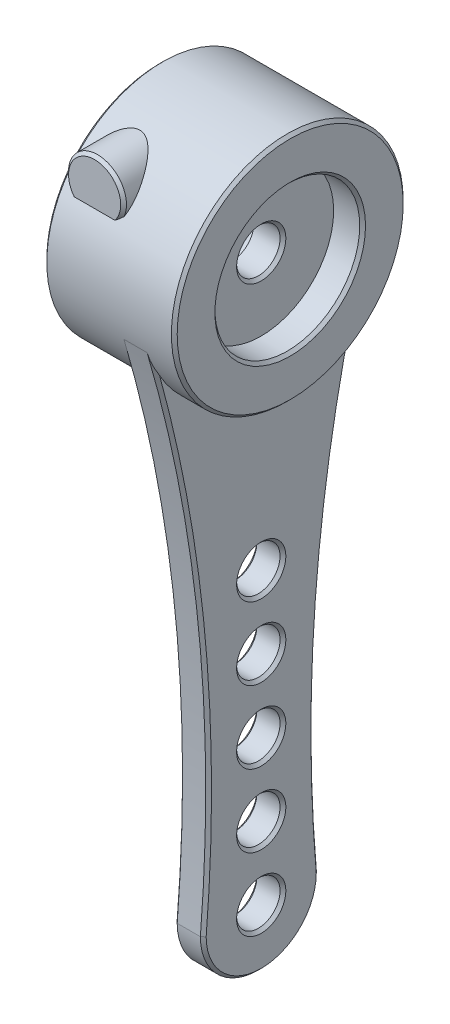
from build123d import *

# Parameters (mm, degrees)
EXTRUDE_1_DEPTH      = 2
EXTRUDE_2_DEPTH      = 4
EXTRUDE_2_DEPTH_BACK = 5
SKETCH_3_R           = 5
CUT_EXTRUDE_1_DEPTH  = 2
SKETCH_4_R           = 1.5
CUT_EXTRUDE_2_DEPTH  = 2
SKETCH_5_R           = 3
CUT_EXTRUDE_3_DEPTH  = 5
EXTRUDE_3_REACH      = 51.588
CHAMFER_1_SIZE       = 0.2
CHAMFER_2_SIZE       = 0.2
CHAMFER_3_SIZE       = 0.2
CHAMFER_4_ANGLE      = 180
CHAMFER_5_SIZE       = 0.2


with BuildPart() as part:
    # 草图1 → 凸台-拉伸1 (new body)
    with BuildSketch(Plane(origin=(0, 0, 0), x_dir=(0, 0, -1), z_dir=(1, 0, 0))):
        with BuildLine():
            ThreePointArc((-4, 0), (-2.828427125, -2.828427125), (0, -4))
            Line((0, -4), (0, -1.5))
            ThreePointArc((0, -1.5), (-1.5, 0), (0, 1.5))
            Line((0, 1.5), (0, 3.5))
            ThreePointArc((0, 3.5), (-1.5, 5), (0, 6.5))
            Line((0, 6.5), (0, 8.5))
            ThreePointArc((0, 8.5), (-1.5, 10), (0, 11.5))
            Line((0, 11.5), (0, 13.5))
            ThreePointArc((0, 13.5), (-1.5, 15), (0, 16.5))
            Line((0, 16.5), (0, 18.5))
            ThreePointArc((0, 18.5), (-1.5, 20), (0, 21.5))
            Line((0, 21.5), (0, 31))
            ThreePointArc((0, 31), (-4.794759251, 32.596072789), (-7.67632231, 36.747429069))
            ThreePointArc((-7.67632231, 36.747429069), (-4.127055678, 18.544898625), (-4, 0))
        make_face()
        with BuildLine():
            Line((0, -1.5), (0, -4))
            ThreePointArc((0, -4), (2.828427125, -2.828427125), (4, 0))
            ThreePointArc((4, 0), (4.127055678, 18.544898625), (7.67632231, 36.747429069))
            ThreePointArc((7.67632231, 36.747429069), (4.794759251, 32.596072789), (0, 31))
            Line((0, 31), (0, 21.5))
            ThreePointArc((0, 21.5), (1.060660172, 21.060660172), (1.5, 20))
            ThreePointArc((1.5, 20), (1.060660172, 18.939339828), (0, 18.5))
            Line((0, 18.5), (0, 16.5))
            ThreePointArc((0, 16.5), (1.060660172, 16.060660172), (1.5, 15))
            ThreePointArc((1.5, 15), (1.060660172, 13.939339828), (0, 13.5))
            Line((0, 13.5), (0, 11.5))
            ThreePointArc((0, 11.5), (1.060660172, 11.060660172), (1.5, 10))
            ThreePointArc((1.5, 10), (1.060660172, 8.939339828), (0, 8.5))
            Line((0, 8.5), (0, 6.5))
            ThreePointArc((0, 6.5), (1.060660172, 6.060660172), (1.5, 5))
            ThreePointArc((1.5, 5), (1.060660172, 3.939339828), (0, 3.5))
            Line((0, 3.5), (0, 1.5))
            ThreePointArc((0, 1.5), (1.060660172, 1.060660172), (1.5, 0))
            ThreePointArc((1.5, 0), (1.060660172, -1.060660172), (0, -1.5))
        make_face()
    extrude(amount=EXTRUDE_1_DEPTH)

    # 草图2 → 凸台-拉伸2 (add, two sides: drawn at the far end of the back side and taken through both)
    with BuildSketch(Plane(origin=(0, 0, 0), x_dir=(0, 0, -1), z_dir=(1, 0, 0)).offset(-EXTRUDE_2_DEPTH_BACK)):
        with BuildLine():
            ThreePointArc((0, 47), (-8, 39), (0, 31))
            Line((0, 31), (0, 47))
        make_face()
        with BuildLine():
            Line((0, 47), (0, 31))
            ThreePointArc((0, 31), (5.656854249, 33.343145751), (8, 39))
            ThreePointArc((8, 39), (5.656854249, 44.656854249), (0, 47))
        make_face()
    extrude(amount=EXTRUDE_2_DEPTH + EXTRUDE_2_DEPTH_BACK)

    # 草图3 → 切除-拉伸1 (cut)
    with BuildSketch(Plane(origin=(4, 0, 0), x_dir=(0, 0, -1), z_dir=(1, 0, 0))):
        with Locations((0, 39)):
            Circle(SKETCH_3_R)
    extrude(amount=-CUT_EXTRUDE_1_DEPTH, mode=Mode.SUBTRACT)

    # 草图4 → 切除-拉伸2 (cut)
    with BuildSketch(Plane(origin=(2, 0, 0), x_dir=(0, 0, -1), z_dir=(1, 0, 0))):
        with Locations((0, 39)):
            Circle(SKETCH_4_R)
    extrude(amount=-CUT_EXTRUDE_2_DEPTH, mode=Mode.SUBTRACT)

    # 草图5 → 切除-拉伸3 (cut)
    with BuildSketch(Plane.ZY.offset(5)):
        with Locations((0, 39)):
            Circle(SKETCH_5_R)
    extrude(amount=-CUT_EXTRUDE_3_DEPTH, mode=Mode.SUBTRACT)

    # 草图7 → 凸台-拉伸3 (add, up to next)
    with BuildSketch(Plane.XY.offset(7), mode=Mode.PRIVATE) as extrude_3_sk1:
        with BuildLine():
            Line((-4.005881134, 42.683822956), (-0.994118866, 42.683822956))
            ThreePointArc((-0.994118866, 42.683822956), (-2.5, 46), (-4.005881134, 42.683822956))
        make_face()
    extrude_3_tool1 = extrude(extrude_3_sk1.sketch, amount=-EXTRUDE_3_REACH, mode=Mode.PRIVATE) - part.part
    add(extrude_3_tool1.solids().sort_by_distance((-2.5, 44.204391, 7))[0])

    # 倒角1
    chamfer_1_edges = [part.edges().sort_by_distance(p)[0] for p in [
        (-5, 39, -3),
        (4, 31, 0),
        (-5, 31, 0),
        (-2.5, 46, 7),
        (4, 39, 5),
    ]]
    chamfer(chamfer_1_edges, length=CHAMFER_1_SIZE)

    # 倒角2
    chamfer_2_edges = [part.edges().sort_by_distance(p)[0] for p in [
        (2, 1.5, 0),
        (0, 21.5, 0),
        (0, 16.5, 0),
        (0, 11.5, 0),
        (2, 6.5, 0),
        (0, 6.5, 0),
        (0, 1.5, 0),
        (2, 11.5, 0),
        (2, 16.5, 0),
        (2, 21.5, 0),
    ]]
    chamfer(chamfer_2_edges, length=CHAMFER_2_SIZE)

    # 倒角3
    # the kernel refuses this chamfer: 0.2 mm, written as the material it takes off along each edge
    with BuildSketch(Plane(origin=(0, 8.590292429, 103.630351179), x_dir=(0, 0.3061524264248754, -0.9519825060336777), z_dir=(0, 0.9519825060336777, 0.3061524264248754))) as chamfer_3_piece_1_section:
        Polygon((100 + CHAMFER_3_SIZE, 0), (100, -CHAMFER_3_SIZE), (100, 0), align=None)
    chamfer_3_piece_1 = revolve(axis=Axis((0, 8.590292429, 103.630351179), (-1, 0, 0)), revolution_arc=23.639557958, mode=Mode.PRIVATE)
    chamfer_3_piece_1 = chamfer_3_piece_1 - Plane(origin=(0, 39, 0), x_dir=(0, 1, 0), z_dir=(-1, 0, 0)) * Cylinder(8, 401, mode=Mode.PRIVATE)
    add(chamfer_3_piece_1, mode=Mode.SUBTRACT)
    with BuildSketch(Plane(origin=(0, 8.590292429, -103.630351179), x_dir=(0, -0.10126549371899889, 0.9948594371979629), z_dir=(0, -0.9948594371979629, -0.10126549371899889))) as chamfer_3_piece_2_section:
        Polygon((100 + CHAMFER_3_SIZE, 0), (100, -CHAMFER_3_SIZE), (100, 0), align=None)
    chamfer_3_piece_2 = revolve(axis=Axis((0, 8.590292429, -103.630351179), (-1, 0, 0)), revolution_arc=23.639557958, mode=Mode.PRIVATE)
    chamfer_3_piece_2 = chamfer_3_piece_2 - Plane(origin=(0, 39, 0), x_dir=(0, 1, 0), z_dir=(-1, 0, 0)) * Cylinder(8, 401, mode=Mode.PRIVATE)
    add(chamfer_3_piece_2, mode=Mode.SUBTRACT)
    with BuildSketch(Plane(origin=(2, 8.590292429, -103.630351179), x_dir=(0, -0.10126549371899889, 0.9948594371979629), z_dir=(0, -0.9948594371979629, -0.10126549371899889))) as chamfer_3_piece_3_section:
        Polygon((100, CHAMFER_3_SIZE), (100 + CHAMFER_3_SIZE, 0), (100, 0), align=None)
    chamfer_3_piece_3 = revolve(axis=Axis((2, 8.590292429, -103.630351179), (-1, 0, 0)), revolution_arc=23.639557958, mode=Mode.PRIVATE)
    chamfer_3_piece_3 = chamfer_3_piece_3 - Plane(origin=(2, 39, 0), x_dir=(0, 1, 0), z_dir=(-1, 0, 0)) * Cylinder(8, 401, mode=Mode.PRIVATE)
    add(chamfer_3_piece_3, mode=Mode.SUBTRACT)
    with BuildSketch(Plane(origin=(2, 8.590292429, 103.630351179), x_dir=(0, 0.3061524264248754, -0.9519825060336777), z_dir=(0, 0.9519825060336777, 0.3061524264248754))) as chamfer_3_piece_4_section:
        Polygon((100, CHAMFER_3_SIZE), (100 + CHAMFER_3_SIZE, 0), (100, 0), align=None)
    chamfer_3_piece_4 = revolve(axis=Axis((2, 8.590292429, 103.630351179), (-1, 0, 0)), revolution_arc=23.639557958, mode=Mode.PRIVATE)
    chamfer_3_piece_4 = chamfer_3_piece_4 - Plane(origin=(2, 39, 0), x_dir=(0, 1, 0), z_dir=(-1, 0, 0)) * Cylinder(8, 401, mode=Mode.PRIVATE)
    add(chamfer_3_piece_4, mode=Mode.SUBTRACT)

    # 倒角4: read off the stored shape, not the designer's step
    # 倒角4 outline → 倒角4 (revolve, cut)
    with BuildSketch(Plane.ZX):
        Polygon((4, 2), (3.8, 2), (4, 1.8), align=None)
        Polygon((4, 0), (4, 0.2), (3.8, 0), align=None)
    revolve(axis=Axis((0, 0, 0), (1, 0, 0)), revolution_arc=CHAMFER_4_ANGLE, mode=Mode.SUBTRACT)

    # 倒角5
    chamfer_5_edges = [part.edges().sort_by_distance(p)[0] for p in [
        (2, 39, 1.5),
    ]]
    chamfer(chamfer_5_edges, length=CHAMFER_5_SIZE)


solid = part.part
